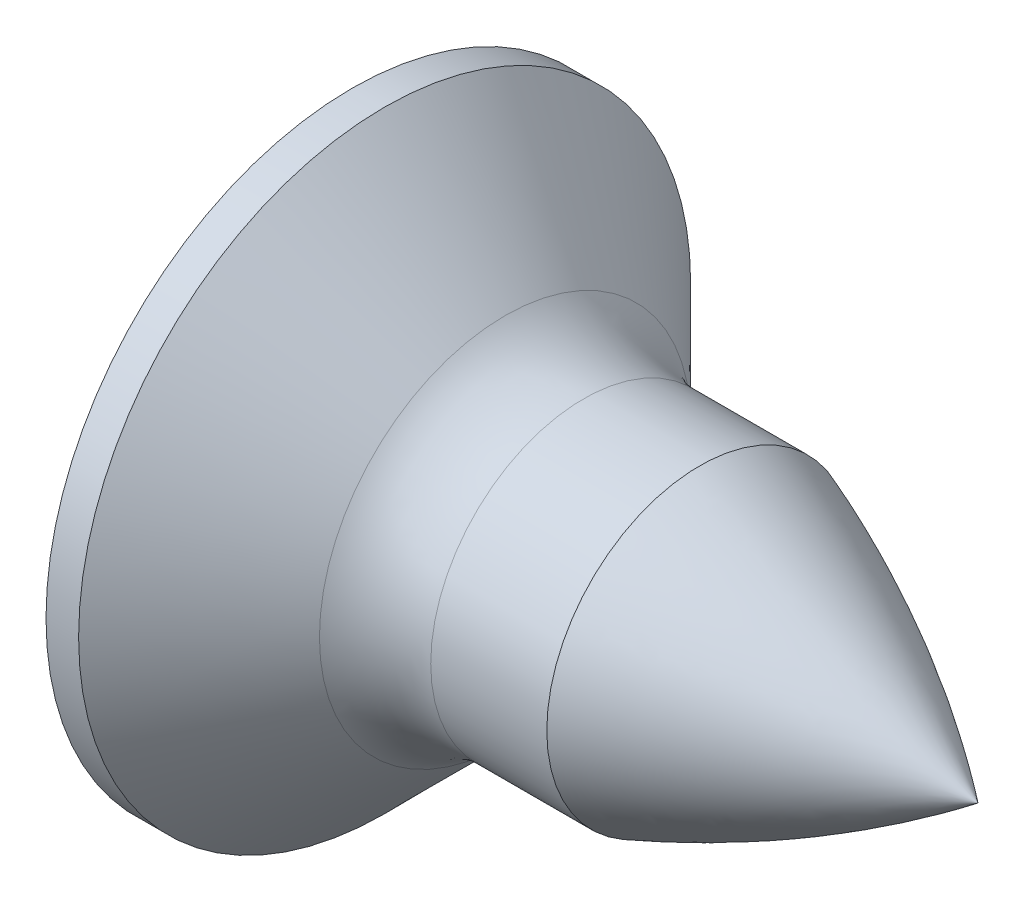
from build123d import *

# Parameters (mm, degrees)
CROSSRECESS_DEPTH = 0.95
DRAFT1_ANGLE      = 30


with BuildPart() as part:
    # Sketch1 → Base (revolve)
    with BuildSketch(Plane.XY):
        with BuildLine():
            Line((4.5, 0), (4.5, 1.1))
            Line((4.5, 1.1), (1.665685425, 1.1))
            ThreePointArc((1.665685425, 1.1), (1.359538679, 1.160896374), (1.1, 1.334314575))
            Line((1.1, 1.334314575), (0.234314575, 2.2))
            Line((0.234314575, 2.2), (0, 2.2))
            Line((0, 2.2), (0, 0))
            Line((0, 0), (4.5, 0))
        make_face()
    revolve(axis=Axis((-96.385195531, 0, 0), (1, 0, 0)))

    # Sketch2 → CrossRecess (cut)
    with BuildSketch(Plane(origin=(0, -0.762930721, -8.381824449), x_dir=(0, 0, 1), z_dir=(-1, 0, 0))):
        Polygon((8.581824449, 1.762930721), (8.181824449, 1.762930721), (8.181824449, 0.962930721), (7.381824449, 0.962930721), (7.381824449, 0.562930721), (8.181824449, 0.562930721), (8.181824449, -0.237069279), (8.581824449, -0.237069279), (8.581824449, 0.562930721), (9.381824449, 0.562930721), (9.381824449, 0.962930721), (8.581824449, 0.962930721), align=None)
    extrude(amount=-CROSSRECESS_DEPTH, mode=Mode.SUBTRACT)

    # Draft1
    draft1_faces = [part.faces().sort_by_distance(p)[0] for p in [
        (0.475, -1, 0),
        (0.475, 0, 1),
        (0.475, 0, -1),
        (0.475, 1, 0),
    ]]
    draft(draft1_faces, Plane(origin=(0, 2.2, 0), x_dir=(0, 0, -1), z_dir=(-1, 0, 0)), DRAFT1_ANGLE)

    # Sketch5 → Cut-Revolve6 (revolve, cut)
    with BuildSketch(Plane(origin=(0, 0, 0), x_dir=(1, 0, 0), z_dir=(0, 1, 0))):
        with BuildLine():
            Line((4.5, 0), (5, 0))
            Line((5, 0), (5, -1.1))
            Line((5, -1.1), (4.5, -1.1))
            Line((4.5, -1.1), (2.5, -1.1))
            ThreePointArc((2.5, -1.1), (3.53943286, -0.621696108), (4.5, 0))
        make_face()
    revolve(axis=Axis((34.740663239, 0, 0), (-1, 0, 0)), mode=Mode.SUBTRACT)


solid = part.part
